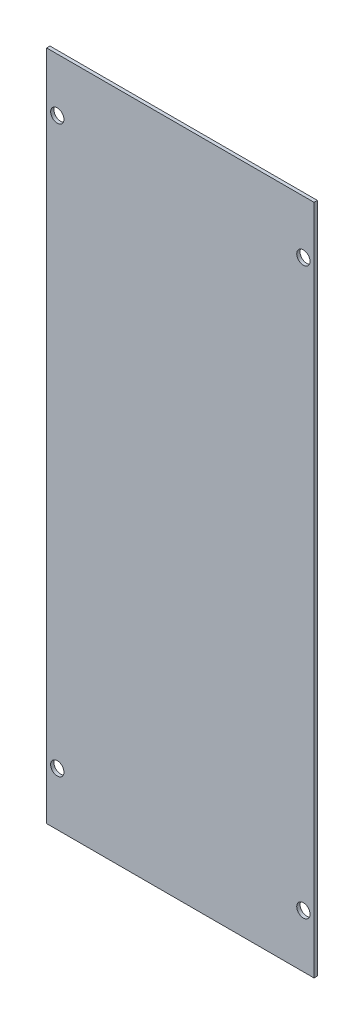
from build123d import *

# Parameters (mm, degrees)
SKETCH1_W            = 127.635
SKETCH1_H            = 320.675
BOSS_EXTRUDE1_DEPTH  = 1.5875
SKETCH2_R            = 3.175
CUT_EXTRUDE1_DEPTH   = 6.35
LPATTERN1_COUNT      = 2
LPATTERN1_PITCH      = 117.475
LPATTERN1_COUNT_DIR2 = 2
LPATTERN1_PITCH_DIR2 = 269.875


with BuildPart() as part:
    # Sketch1 → Boss-Extrude1 (new body)
    with BuildSketch(Plane.XY):
        with Locations((63.8175, 160.3375)):
            Rectangle(SKETCH1_W, SKETCH1_H)
    extrude(amount=BOSS_EXTRUDE1_DEPTH)

    # Sketch2 → Cut-Extrude1 (cut)
    with BuildSketch(Plane.XY.offset(1.5875)):
        with Locations((5.08, 295.275)):
            Circle(SKETCH2_R)
    cut_extrude1 = extrude(amount=-CUT_EXTRUDE1_DEPTH, mode=Mode.SUBTRACT)

    # LPattern1: Cut-Extrude1 2 × 2
    with Locations(*[(i * LPATTERN1_PITCH, -j * LPATTERN1_PITCH_DIR2, 0) for i in range(LPATTERN1_COUNT) for j in range(LPATTERN1_COUNT_DIR2) if (i, j) != (0, 0)]):
        add(cut_extrude1, mode=Mode.SUBTRACT)


solid = part.part
